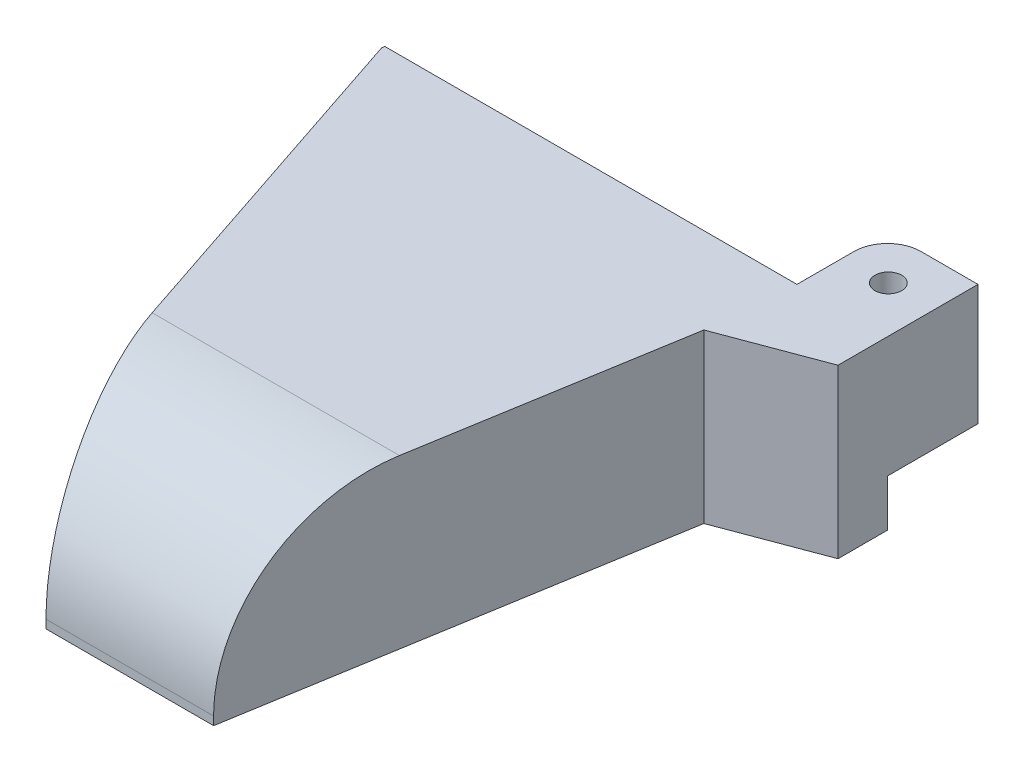
from build123d import *

# Parameters (mm, degrees)
SKETCH_1_W          = 30
SKETCH_1_H          = 6
EXTRUDE_1_DEPTH     = 2
SKETCH_2_R          = 0.8
CUT_EXTRUDE_1_DEPTH = 2
SKETCH_3_W          = 1.6
SKETCH_3_H          = 0.2
EXTRUDE_2_DEPTH     = 10
SKETCH_4_W          = 21.8
SKETCH_4_H          = 0.2
EXTRUDE_3_DEPTH     = 1.6
SKETCH_5_W          = 5
SKETCH_5_H          = 0.2
EXTRUDE_4_DEPTH     = 10
SKETCH_6_W          = 5.4
SKETCH_6_H          = 7.2
EXTRUDE_5_DEPTH     = 5.4
FILLET_1_R          = 2
SKETCH_7_R          = 0.8
CUT_EXTRUDE_2_DEPTH = 32.429922049
SKETCH_8_W          = 6
SKETCH_8_H          = 2
CUT_EXTRUDE_3_DEPTH = 33.86335345
SKETCH_9_W          = 21.8
SKETCH_9_H          = 1.6
EXTRUDE_7_DEPTH     = 0.2
EXTRUDE_9_DEPTH     = 1.6
EXTRUDE_10_REACH    = 49.608
EXTRUDE_11_DEPTH    = 1.6
CUT_EXTRUDE_4_DEPTH = 1.6
FILLET_2_R          = 9
FILLET_3_R          = 9.5
FILLET_4_R          = 1
CHAMFER_1_SIZE      = 12.342759107
CHAMFER_1_SIZE_2    = 5


with BuildPart() as part:
    # 草图1 → 凸台-拉伸1 (new body)
    with BuildSketch(Plane(origin=(0, 0, 0), x_dir=(1, 0, 0), z_dir=(0, 1, 0))):
        with Locations((15, -3)):
            Rectangle(SKETCH_1_W, SKETCH_1_H)
    extrude(amount=EXTRUDE_1_DEPTH)

    # 草图2 → 切除-拉伸1 (cut)
    with BuildSketch(Plane(origin=(0, 2, 0), x_dir=(1, 0, 0), z_dir=(0, 1, 0))):
        with Locations(Location((27.25, -3, 0), (0, 0, 270))):
            Circle(SKETCH_2_R)
    extrude(amount=-CUT_EXTRUDE_1_DEPTH, mode=Mode.SUBTRACT)

    # 草图3 → 凸台-拉伸2 (add)
    with BuildSketch(Plane(origin=(0, 2, 0), x_dir=(1, 0, 0), z_dir=(0, 1, 0))):
        with Locations((0.8, -5.9)):
            Rectangle(SKETCH_3_W, SKETCH_3_H)
        with Locations((24.2, -5.9)):
            Rectangle(SKETCH_3_W, SKETCH_3_H)
    extrude(amount=EXTRUDE_2_DEPTH)

    # 草图4 → 凸台-拉伸3 (add)
    with BuildSketch(Plane(origin=(0, 12, 0), x_dir=(1, 0, 0), z_dir=(0, 1, 0))):
        with Locations((12.5, -5.9)):
            Rectangle(SKETCH_4_W, SKETCH_4_H)
    extrude(amount=-EXTRUDE_3_DEPTH)

    # 草图5 → 凸台-拉伸4 (add)
    with BuildSketch(Plane(origin=(0, 2, 0), x_dir=(1, 0, 0), z_dir=(0, 1, 0))):
        with Locations((27.5, -5.9)):
            Rectangle(SKETCH_5_W, SKETCH_5_H)
    extrude(amount=EXTRUDE_4_DEPTH)

    # 草图6 → 凸台-拉伸5 (add)
    with BuildSketch(Plane(origin=(0, 0, 5.8), x_dir=(-1, 0, 0), z_dir=(0, 0, -1))):
        with Locations((-27.3, 8.4)):
            Rectangle(SKETCH_6_W, SKETCH_6_H)
    extrude(amount=EXTRUDE_5_DEPTH)

    # 圆角1
    fillet_1_edges = [part.edges().sort_by_distance(p)[0] for p in [
        (24.6, 8.4, 0.4),
    ]]
    fillet(fillet_1_edges, radius=FILLET_1_R)

    # 草图7 → 切除-拉伸2 (cut, through all)
    with BuildSketch(Plane(origin=(0, 4.8, 0), x_dir=(-1, 0, 0), z_dir=(0, -1, 0))):
        with Locations(Location((-27.25, -3, 0), (0, 0, 270))):
            Circle(SKETCH_7_R)
    extrude(amount=-CUT_EXTRUDE_2_DEPTH, mode=Mode.SUBTRACT)

    # 草图8 → 切除-拉伸3 (cut, through all)
    with BuildSketch(Plane.ZY):
        with Locations((3, 1)):
            Rectangle(SKETCH_8_W, SKETCH_8_H)
    extrude(amount=-CUT_EXTRUDE_3_DEPTH, mode=Mode.SUBTRACT)

    # 草图9 → 凸台-拉伸7 (add)
    with BuildSketch(Plane.XY.offset(6)):
        with Locations((12.5, 2.8)):
            Rectangle(SKETCH_9_W, SKETCH_9_H)
    extrude(amount=-EXTRUDE_7_DEPTH)

    # 草图11 → 凸台-拉伸9 (add)
    with BuildSketch(Plane(origin=(0, 2, 0), x_dir=(-1, 0, 0), z_dir=(0, -1, 0))):
        Polygon((0, -6), (-10, -36), (-20, -36), (-25, -6), align=None)
    extrude(amount=-EXTRUDE_9_DEPTH)

    # 凸台-拉伸10: up to this face of the body (flat: up to its plane)
    extrude_10_end = Plane(part.part.faces().sort_by_distance((25.077544524, 12, 3.686395467))[0])
    # 草图12 → 凸台-拉伸10 (add, up to the picked face)
    with BuildSketch(Plane(origin=(0, 3.6, 0), x_dir=(1, 0, 0), z_dir=(0, 1, 0)), mode=Mode.PRIVATE) as extrude_10_sk1:
        Polygon((2.219881419, -7.6), (11.153214752, -34.4), (18.644596659, -34.4), (23.111263325, -7.6), (23.4, -6), (25, -6), (20, -36), (10, -36), (0, -6), (1.6, -6), align=None)
    extrude_10_tool1 = split(extrude(extrude_10_sk1.sketch, amount=EXTRUDE_10_REACH, mode=Mode.PRIVATE), bisect_by=extrude_10_end, keep=Keep.BOTH, mode=Mode.PRIVATE)
    add(extrude_10_tool1.solids().sort_by(Axis((6.316075, 3.6, 21.123491), (0, 1, 0)))[0])

    # 草图13 → 凸台-拉伸11 (add)
    with BuildSketch(Plane(origin=(0, 12, 0), x_dir=(1, 0, 0), z_dir=(0, 1, 0))):
        Polygon((1.6, -5.8), (1.6, -6), (2.219881419, -7.6), (11.153214752, -34.4), (18.644596659, -34.4), (23.111263325, -7.6), (23.4, -6), (23.4, -5.8), align=None)
    extrude(amount=-EXTRUDE_11_DEPTH)

    # 草图15 → 切除-拉伸4 (cut)
    with BuildSketch(Plane.XZ.offset(-2)):
        Polygon((11.153214752, 34.4), (18.644596659, 34.4), (19.311263325, 30.4), (9.819881419, 30.4), align=None)
    extrude(amount=-CUT_EXTRUDE_4_DEPTH, mode=Mode.SUBTRACT)

    # 圆角2
    # the kernel refuses this fillet: 9 mm, written as the material it adds along each edge
    with BuildSketch(Plane(origin=(-11.296729569, 10.4, 34.4), x_dir=(0, -1, 0), z_dir=(1, 0, 0))) as fillet_2_piece_1_section:
        with BuildLine():
            CenterArc((9, 8.979977728), FILLET_2_R, 180, 86.177446271)
            Line((0, 8.979977728), (-0.18, 8.979977728))
            Line((-0.18, 8.979977728), (-0.18, 0))
            Line((-0.18, 0), (0, -0.18))
            ThreePointArc((0, -0.18), (4.2, -0.18), (8.388, -0.179599555))
            Line((8.388, -0.179599555), (8.4, 0))
        make_face()
    fillet_2_piece_1 = extrude(amount=52.391270548, mode=Mode.PRIVATE)
    fillet_2_piece_1 = split(fillet_2_piece_1, bisect_by=Plane(origin=(10.82791011, 8.54108789, 33.424086075), z_dir=(0.9486832980505115, 0, -0.3162277660168449)), keep=Keep.TOP, mode=Mode.PRIVATE)
    fillet_2_piece_1 = split(fillet_2_piece_1, bisect_by=Plane(origin=(18.906334999, 8.54108789, 32.829569958), z_dir=(-0.9863939238321403, 0, -0.16439898730537805)), keep=Keep.TOP, mode=Mode.PRIVATE)
    add(fillet_2_piece_1)

    # 圆角3
    fillet_3_edges = [part.edges().sort_by_distance(p)[0] for p in [
        (15, 12, 36),
    ]]
    fillet(fillet_3_edges, radius=FILLET_3_R)

    # 圆角4
    fillet_4_edges = [part.edges().sort_by_distance(p)[0] for p in [
        (14.565572372, 3.6, 30.4),
    ]]
    fillet(fillet_4_edges, radius=FILLET_4_R)

    # 倒角1
    # the kernel refuses this chamfer: 12.342759107, 5 mm, written as the material it adds along each edge
    with BuildSketch(Plane(origin=(25, 12, 6), x_dir=(0.9999085325872852, 0, -0.013525030837001994), z_dir=(0, -1, 0))) as chamfer_1_piece_1_section:
        Polygon((CHAMFER_1_SIZE * 0.99990853261, CHAMFER_1_SIZE * 0.0135250308373), (-CHAMFER_1_SIZE_2 * 0.177724958393, CHAMFER_1_SIZE_2 * 0.984080199559), (0, 0), align=None)
    chamfer_1_piece_1 = extrude(amount=10, mode=Mode.PRIVATE)
    chamfer_1_piece_1 = split(chamfer_1_piece_1, bisect_by=Plane(origin=(30, 7, 7.970980812), z_dir=(-1, 0, 0)), keep=Keep.TOP, mode=Mode.PRIVATE)
    add(chamfer_1_piece_1)


solid = part.part
